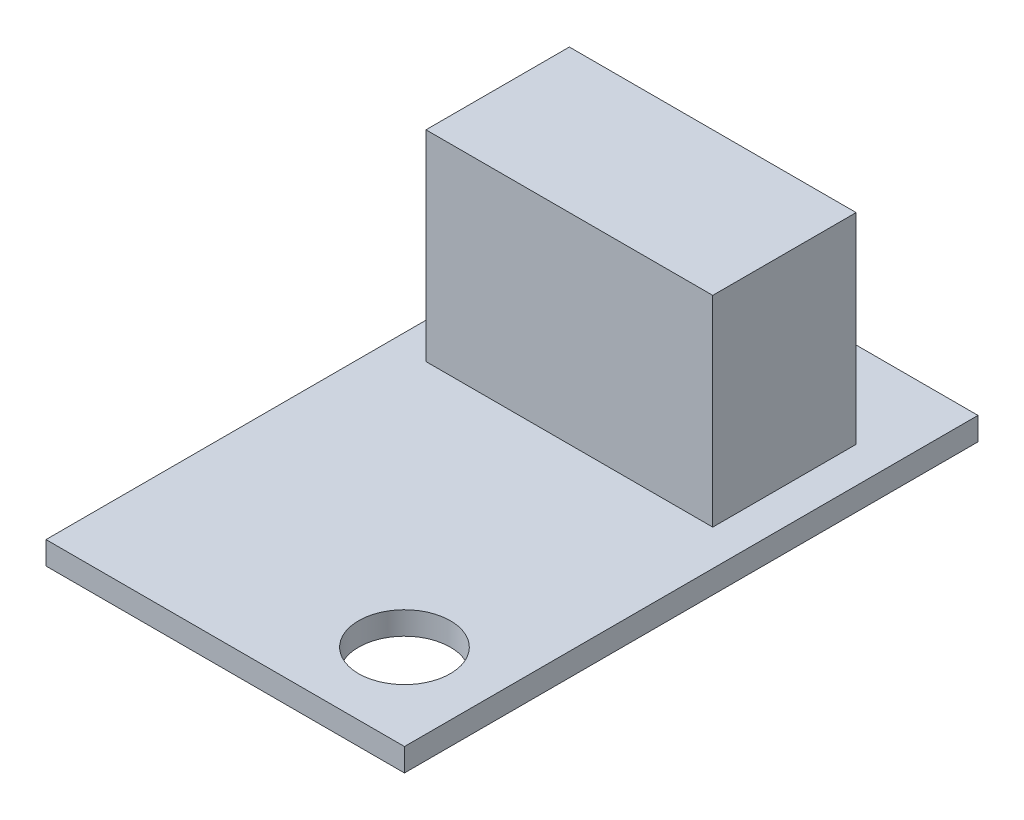
from build123d import *

# Parameters (mm, degrees)
SKETCH1_W           = 12.5
SKETCH1_H           = 20
SKETCH1_R           = 1.6
BOSS_EXTRUDE1_DEPTH = 0.8
SKETCH2_W           = 10
SKETCH2_H           = 5
BOSS_EXTRUDE2_DEPTH = 7


with BuildPart() as part:
    # Sketch1 → Boss-Extrude1 (new body)
    with BuildSketch(Plane(origin=(0, 0, 0), x_dir=(1, 0, 0), z_dir=(0, 1, 0))):
        with Locations((0, 10)):
            Rectangle(SKETCH1_W, SKETCH1_H)
        with Locations((3.25, 3)):
            Circle(SKETCH1_R, mode=Mode.SUBTRACT)
    extrude(amount=BOSS_EXTRUDE1_DEPTH)

    # Sketch2 → Boss-Extrude2 (add)
    with BuildSketch(Plane(origin=(0, 0.8, 0), x_dir=(1, 0, 0), z_dir=(0, 1, 0))):
        with Locations((0, 14.5)):
            Rectangle(SKETCH2_W, SKETCH2_H)
    extrude(amount=BOSS_EXTRUDE2_DEPTH)


solid = part.part
